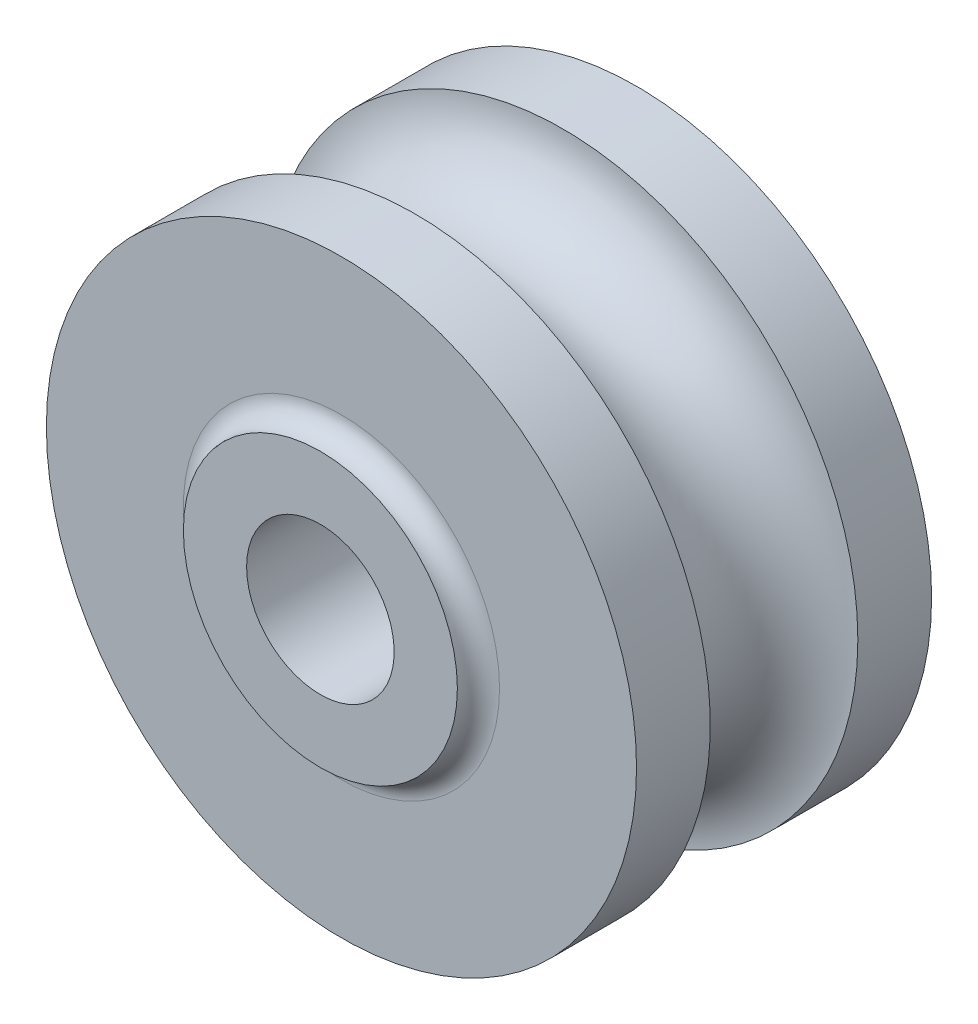
from build123d import *
from build123d.topology import SkipClean

# Parameters (mm, degrees)
SKETCH1_R           = 28
SKETCH1_R_2         = 7
BOSS_EXTRUDE1_DEPTH = 28
BOSS_EXTRUDE2_START = 2
SKETCH2_R           = 13
SKETCH2_R_2         = 7
BOSS_EXTRUDE2_DEPTH = 2
SKETCH3_R           = 7
FILLET1_R           = 2
FILLET2_R           = 2


with BuildPart() as part:
    # Sketch1 → Boss-Extrude1 (new body)
    with BuildSketch(Plane.XY):
        Circle(SKETCH1_R)
        Circle(SKETCH1_R_2, mode=Mode.SUBTRACT)
    extrude(amount=BOSS_EXTRUDE1_DEPTH)

    # Sketch2 → Boss-Extrude2 (add)
    with SkipClean():  # the faces are left unmerged after this step: merging them gives an invalid solid
        with BuildSketch(Plane(origin=(0, 0, 0), x_dir=(-1, 0, 0), z_dir=(0, 0, -1)).offset(BOSS_EXTRUDE2_START)):
            with Locations(Location((0, 0, 0), (0, 0, 180))):
                Circle(SKETCH2_R)
            Circle(SKETCH2_R_2, mode=Mode.SUBTRACT)
        boss_extrude2 = extrude(amount=-BOSS_EXTRUDE2_DEPTH)

    # Mirror1: Boss-Extrude2 across plane
    add(boss_extrude2.mirror(Plane.XY.offset(14)))

    # Sketch3 → Cut-Revolve1 (revolve, cut)
    with BuildSketch(Plane(origin=(0, 0, 0), x_dir=(0, 0, -1), z_dir=(1, 0, 0)), mode=Mode.PRIVATE) as cut_revolve1_sk:
        with Locations((-14, 28)):
            Circle(SKETCH3_R)
    revolve(cut_revolve1_sk.sketch.rotate(Axis((0, 0, 0), (0, 0, 1)), 90), axis=Axis((0, 0, 0), (0, 0, 1)), mode=Mode.SUBTRACT)

    # Fillet1
    fillet1_edges = [part.edges().sort_by_distance(p)[0] for p in [
        (-13, 0, 0),
    ]]
    fillet(fillet1_edges, radius=FILLET1_R - 0.0001)  # a hair under: the kernel refuses the full size

    # Fillet2
    fillet2_edges = [part.edges().sort_by_distance(p)[0] for p in [
        (-13, 0, 28),
    ]]
    fillet(fillet2_edges, radius=FILLET2_R - 0.0001)  # a hair under: the kernel refuses the full size


solid = part.part
